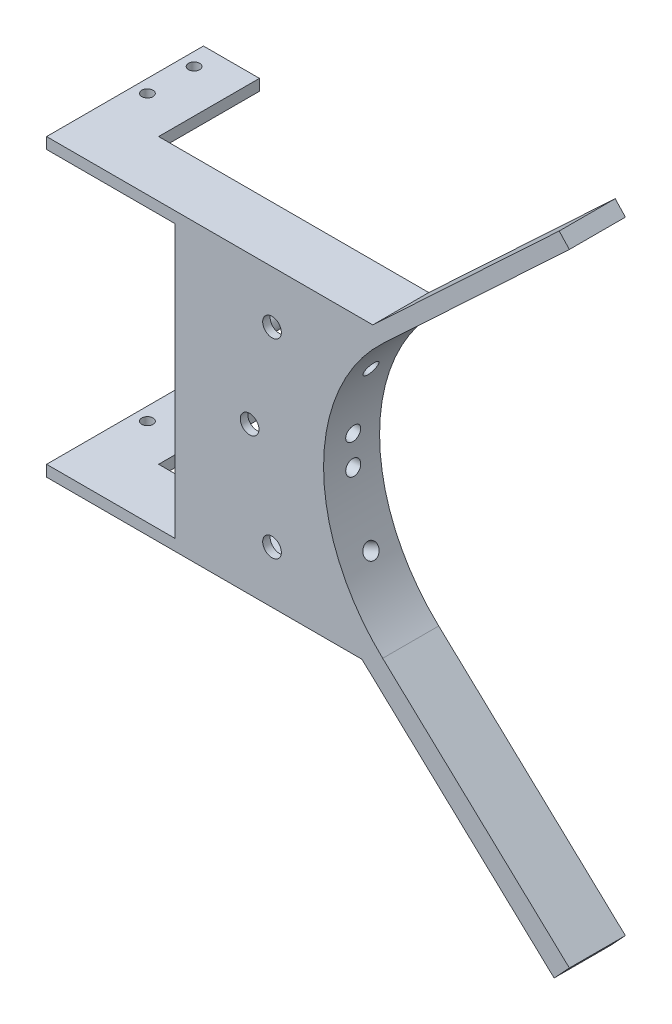
from build123d import *

# Parameters (mm, degrees)
SKETCH1_R            = 1.5
BOSS_EXTRUDE1_DEPTH  = 3
BOSS_EXTRUDE2_DEPTH  = 15
BOSS_EXTRUDE4_DEPTH  = 2
CUT_SWEEP1_START     = -39.833089264
CUT_SWEEP1_OUTLINE_R = 2
CUT_SWEEP1_DEPTH     = 5.418212301
SKETCH13_R           = 2
CUT_EXTRUDE1_REACH   = 160.497
SKETCH14_R           = 2.5
SKETCH15_R           = 2.5
BOSS_EXTRUDE5_DEPTH  = 10
SKETCH16_R           = 2.5
CUT_EXTRUDE2_DEPTH   = 10


# Read off the part's stored shape, not the designer's step: Cut-Sweep1
with BuildPart() as part:
    # Sketch1 → Boss-Extrude1 (new body)
    with BuildSketch(Plane(origin=(0, 0, 0), x_dir=(1, 0, 0), z_dir=(0, 1, 0))):
        Polygon((-90, 42), (-90, 0), (0, 0), (0, 15), (-75, 15), (-75, 42), align=None)
        with Locations(Location((-86.5, 36, 0), (0, 0, 270))):
            Circle(SKETCH1_R, mode=Mode.SUBTRACT)
        with Locations(Location((-86.5, 23.5, 0), (0, 0, 270))):
            Circle(SKETCH1_R, mode=Mode.SUBTRACT)
    extrude(amount=BOSS_EXTRUDE1_DEPTH)


with BuildPart() as body_2:
    # Mirror7: mirrored copy
    add(part.part.mirror(Plane.ZX.offset(-36.5)))


with BuildPart() as part_1:
    add(part.part)

    add(body_2.part)  # Boss-Extrude2 merges body 2
    # Sketch3 → Boss-Extrude2 (add)
    with BuildSketch(Plane.XY):
        with BuildLine():
            Line((0, 0), (50, 46.811448287))
            Line((50, 46.811448287), (47.26621142, 49.731448287))
            Line((47.26621142, 49.731448287), (-2.73378858, 2.92))
            ThreePointArc((-2.73378858, 2.92), (-20.424933424, -35.957501235), (-5.557687519, -76))
            Line((-5.557687519, -76), (45.907254912, -124.182969825))
            Line((45.907254912, -124.182969825), (50, -119.811448287))
            Line((50, -119.811448287), (0, -73))
            ThreePointArc((0, -73), (-15.82764275, -36.5), (0, 0))
        make_face()
    extrude(amount=-BOSS_EXTRUDE2_DEPTH)

    # Sketch4 → Boss-Extrude4 (add)
    with BuildSketch(Plane.XY):
        with BuildLine():
            Line((-8.143678765, -73), (-55.631592513, -73))
            Line((-55.631592513, -73), (-55.631592513, 0))
            Line((-55.631592513, 0), (-5.631592513, 0))
            ThreePointArc((-5.631592513, 0), (-20.427620409, -36.034060143), (-8.143678765, -73))
        make_face()
    extrude(amount=-BOSS_EXTRUDE4_DEPTH)

    # Cut-Sweep1 outline → Cut-Sweep1 (cut)
    with BuildSketch(Plane(origin=(0, 0, 0), x_dir=(-0.4226182617406999, 0.9063077870366498, 0), z_dir=(0.9063077870366498, 0.4226182617406999, 0)).offset(CUT_SWEEP1_START)):
        with Locations((-47.522096447, -8)):
            Circle(CUT_SWEEP1_OUTLINE_R)
    cut_sweep1 = extrude(amount=CUT_SWEEP1_DEPTH, mode=Mode.SUBTRACT)

    # Cut-Sweep2: sweep along a path in Sketch12
    with BuildLine(Plane(origin=(0, 0, -8), x_dir=(-1, 0, 0), z_dir=(0, 0, -1))) as cut_sweep2_path:
        Line((-34.17235725, -36.5), (20.427620409, -40.807723062))
    # Sketch13 → Cut-Sweep2 (sweep, cut)
    with BuildSketch(Plane(origin=(34.17235725, -36.5, -8), x_dir=(0, 0, 1), z_dir=(-0.9969021605356864, -0.07865165172633562, 0))):
        with Locations((0.218000658, -0.010354147)):
            Circle(SKETCH13_R)
    cut_sweep2 = sweep(path=cut_sweep2_path.line, mode=Mode.SUBTRACT)

    # Mirror8: Cut-Sweep1, Cut-Sweep2 across plane
    add(cut_sweep1.mirror(Plane.ZX.offset(-36.5)), mode=Mode.SUBTRACT)
    add(cut_sweep2.mirror(Plane.ZX.offset(-36.5)), mode=Mode.SUBTRACT)

    # Sketch14 → Cut-Extrude1 (cut, up to next)
    with BuildSketch(Plane(origin=(0, 0, -2), x_dir=(-1, 0, 0), z_dir=(0, 0, -1)), mode=Mode.PRIVATE) as cut_extrude1_sk1:
        with Locations((35.631592513, -36.5)):
            Circle(SKETCH14_R)
    cut_extrude1_tool1 = extrude(cut_extrude1_sk1.sketch, amount=-CUT_EXTRUDE1_REACH, mode=Mode.PRIVATE) & part_1.part
    add(cut_extrude1_tool1.solids().sort_by_distance((-35.631593, -36.5, -2))[0], mode=Mode.SUBTRACT)

    # Sketch15 → Boss-Extrude5 (add)
    with BuildSketch(Plane(origin=(0, 0, -2), x_dir=(-1, 0, 0), z_dir=(0, 0, -1))):
        with Locations(Location((40.631592513, -53, 0), (0, 0, 180))):
            Circle(SKETCH15_R)
    boss_extrude5 = extrude(amount=BOSS_EXTRUDE5_DEPTH)

    # Mirror9: Boss-Extrude5 across plane
    add(boss_extrude5.mirror(Plane.ZX.offset(-36.5)))

    # Sketch16 → Cut-Extrude2 (cut)
    with BuildSketch(Plane(origin=(0, 0, -2), x_dir=(-1, 0, 0), z_dir=(0, 0, -1))):
        with Locations((29.631592513, -11)):
            Circle(SKETCH16_R)
    cut_extrude2 = extrude(amount=-CUT_EXTRUDE2_DEPTH, mode=Mode.SUBTRACT)

    # Mirror10: Cut-Extrude2 across plane
    add(cut_extrude2.mirror(Plane.ZX.offset(-36.5)), mode=Mode.SUBTRACT)


solid = part_1.part
